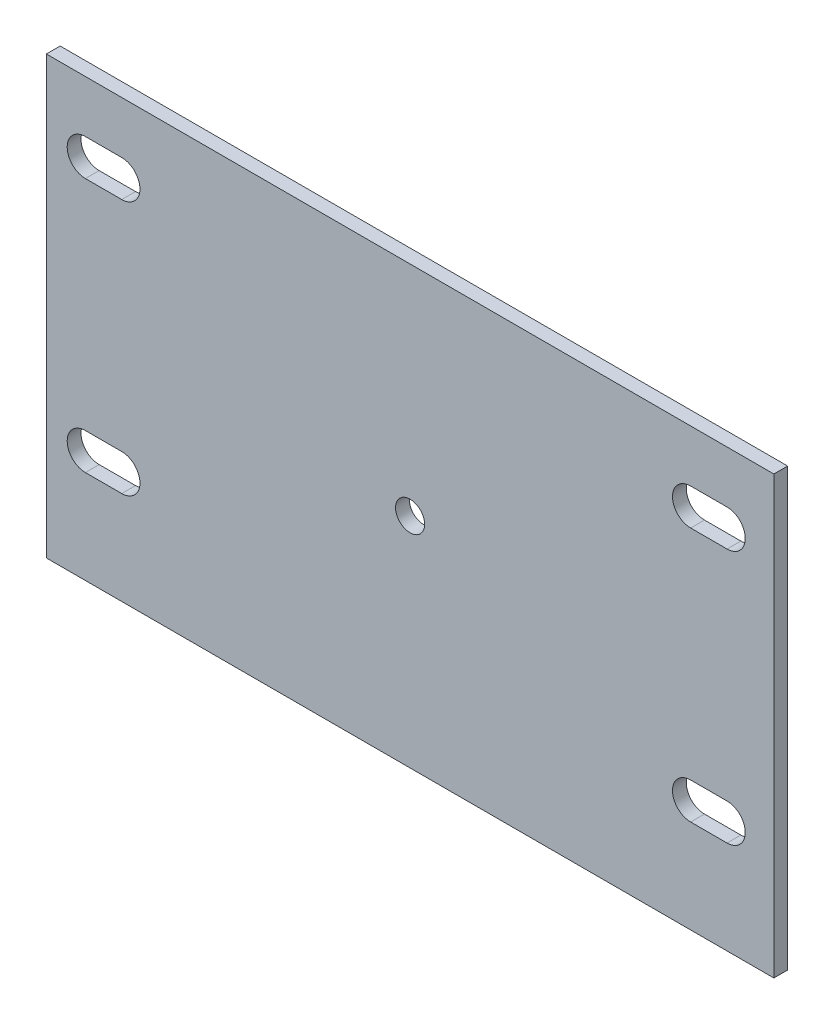
from build123d import *

# Parameters (mm, degrees)
SKETCH1_W          = 100
SKETCH1_H          = 60
BASE_FLANGE1_DEPTH = 1.89738
SKETCH7_R          = 2
CUT_EXTRUDE2_DEPTH = 2


# Sheet-metal steps are written as plain solids
with BuildPart() as part:
    # Sketch1 → Base-Flange1 (new body)
    with BuildSketch(Plane.XY):
        with Locations((-16.008698092, 3.086666862)):
            Rectangle(SKETCH1_W, SKETCH1_H)
    extrude(amount=-BASE_FLANGE1_DEPTH)

    # Sketch7 → Cut-Extrude2 (cut)
    with BuildSketch(Plane.XY):
        with Locations((-16.008698092, 3.086666862)):
            Circle(SKETCH7_R)
        with BuildLine():
            Line((-60.644357263, -9.061184979), (-55.644357263, -9.061184979))
            ThreePointArc((-55.644357263, -9.061184979), (-53.144357263, -11.561184979), (-55.644357263, -14.061184979))
            Line((-55.644357263, -14.061184979), (-60.644357263, -14.061184979))
            ThreePointArc((-60.644357263, -14.061184979), (-63.144357263, -11.561184979), (-60.644357263, -9.061184979))
        make_face()
        with BuildLine():
            Line((-60.644357263, 25.938815021), (-55.644357263, 25.938815021))
            ThreePointArc((-55.644357263, 25.938815021), (-53.144357263, 23.438815021), (-55.644357263, 20.938815021))
            Line((-55.644357263, 20.938815021), (-60.644357263, 20.938815021))
            ThreePointArc((-60.644357263, 20.938815021), (-63.144357263, 23.438815021), (-60.644357263, 25.938815021))
        make_face()
        with BuildLine():
            Line((27.560882737, 20.938815021), (22.560882737, 20.938815021))
            ThreePointArc((22.560882737, 20.938815021), (20.060882737, 23.438815021), (22.560882737, 25.938815021))
            Line((22.560882737, 25.938815021), (27.560882737, 25.938815021))
            ThreePointArc((27.560882737, 25.938815021), (30.060882737, 23.438815021), (27.560882737, 20.938815021))
        make_face()
        with BuildLine():
            Line((27.560882737, -14.061184979), (22.560882737, -14.061184979))
            ThreePointArc((22.560882737, -14.061184979), (20.060882737, -11.561184979), (22.560882737, -9.061184979))
            Line((22.560882737, -9.061184979), (27.560882737, -9.061184979))
            ThreePointArc((27.560882737, -9.061184979), (30.060882737, -11.561184979), (27.560882737, -14.061184979))
        make_face()
    extrude(amount=-CUT_EXTRUDE2_DEPTH, mode=Mode.SUBTRACT)


solid = part.part
